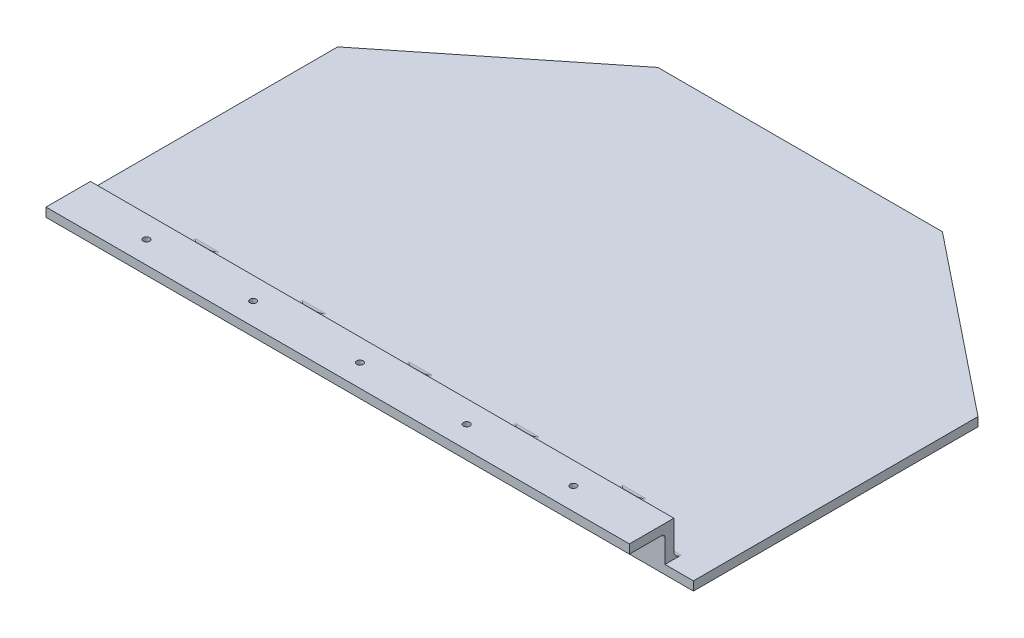
from build123d import *

# Parameters (mm, degrees)
BOSS_EXTRUDE1_DEPTH = 3.175
BOSS_EXTRUDE2_DEPTH = 228.6
BOSS_EXTRUDE3_DEPTH = 1.5875
LPATTERN1_COUNT     = 3
LPATTERN1_PITCH     = 38.1
LPATTERN1_COL_COUNT = 3
LPATTERN1_COL_PITCH = 38.1
SKETCH4_R           = 1.143
CUT_EXTRUDE1_DEPTH  = 192.160313938
LPATTERN2_COUNT     = 3
LPATTERN2_PITCH     = 38.1
LPATTERN2_COL_COUNT = 3
LPATTERN2_COL_PITCH = 38.1
SKETCH5_R           = 1.143
CUT_EXTRUDE3_DEPTH  = 189.638824874
LPATTERN3_COUNT     = 4
LPATTERN3_PITCH     = 38.1
CUT_EXTRUDE4_REACH  = 193.16
SKETCH6_W           = 10.16
SKETCH6_H           = 15.875
FILLET1_R           = 2.54
FILLET2_R           = 1.27


with BuildPart() as part:
    # Sketch1 → Boss-Extrude1 (new body)
    with BuildSketch(Plane(origin=(0, 0, 0), x_dir=(1, 0, 0), z_dir=(0, 1, 0))):
        Polygon((-114.3, 0), (114.3, 0), (114.3, 101.6), (50.8, 152.4), (-50.8, 152.4), (-114.3, 101.6), align=None)
    extrude(amount=BOSS_EXTRUDE1_DEPTH)

    # Sketch2 → Boss-Extrude2 (add)
    with BuildSketch(Plane(origin=(114.3, 0, 0), x_dir=(0, 0, -1), z_dir=(1, 0, 0))):
        Polygon((3.175, 3.175), (3.175, 15.875), (-12.7, 15.875), (-12.7, 12.7), (0, 12.7), (0, 3.175), align=None)
    extrude(amount=-BOSS_EXTRUDE2_DEPTH)

    # Sketch3 → Boss-Extrude3 (add, symmetric)
    with BuildSketch(Plane(origin=(0, 0, 0), x_dir=(0, 0, -1), z_dir=(1, 0, 0))):
        Polygon((3.175, 15.875), (15.875, 3.175), (3.175, 3.175), align=None)
    boss_extrude3 = extrude(amount=BOSS_EXTRUDE3_DEPTH, both=True)

    # LPattern1: Boss-Extrude3 ×3
    with Locations(*[(-i * LPATTERN1_PITCH, 0, 0) for i in range(1, LPATTERN1_COUNT)]):
        add(boss_extrude3)

    # LPattern1 col: Boss-Extrude3 ×3
    with Locations(*[(i * LPATTERN1_COL_PITCH, 0, 0) for i in range(1, LPATTERN1_COL_COUNT)]):
        add(boss_extrude3)

    # Sketch4 → Cut-Extrude1 (cut, through all)
    with BuildSketch(Plane(origin=(0, 15.875, 0), x_dir=(1, 0, 0), z_dir=(0, 1, 0))):
        with Locations(Location((0, -4.7625, 0), (0, 0, 270))):
            Circle(SKETCH4_R)
    cut_extrude1 = extrude(amount=-CUT_EXTRUDE1_DEPTH, mode=Mode.SUBTRACT)

    # LPattern2: Cut-Extrude1 ×3
    with Locations(*[(i * LPATTERN2_PITCH, 0, 0) for i in range(1, LPATTERN2_COUNT)]):
        add(cut_extrude1, mode=Mode.SUBTRACT)

    # LPattern2 col: Cut-Extrude1 ×3
    with Locations(*[(-i * LPATTERN2_COL_PITCH, 0, 0) for i in range(1, LPATTERN2_COL_COUNT)]):
        add(cut_extrude1, mode=Mode.SUBTRACT)

    # Sketch5 → Cut-Extrude3 (cut, through all)
    with BuildSketch(Plane(origin=(0, 0, -3.175), x_dir=(-1, 0, 0), z_dir=(0, 0, -1))):
        with Locations((-57.15, 8.382)):
            Circle(SKETCH5_R)
    cut_extrude3 = extrude(amount=-CUT_EXTRUDE3_DEPTH, mode=Mode.SUBTRACT)

    # LPattern3: Cut-Extrude3 ×4
    with Locations(*[(-i * LPATTERN3_PITCH, 0, 0) for i in range(1, LPATTERN3_COUNT)]):
        add(cut_extrude3, mode=Mode.SUBTRACT)

    # Cut-Extrude4: up to this face of the body (flat: up to its plane)
    cut_extrude4_end = Plane(part.part.faces().sort_by_distance((0, 3.175, -72.172492335))[0])
    # Sketch6 → Cut-Extrude4 (cut, up to the picked face)
    with BuildSketch(Plane(origin=(0, 15.875, 0), x_dir=(1, 0, 0), z_dir=(0, 1, 0)), mode=Mode.PRIVATE) as cut_extrude4_sk1:
        with Locations((109.22, -4.7625)):
            Rectangle(SKETCH6_W, SKETCH6_H)
    cut_extrude4_tool1 = split(extrude(cut_extrude4_sk1.sketch, amount=-CUT_EXTRUDE4_REACH, mode=Mode.PRIVATE), bisect_by=cut_extrude4_end, keep=Keep.BOTH, mode=Mode.PRIVATE)
    # Sketch6 → Cut-Extrude4 (cut, up to the picked face)
    with BuildSketch(Plane(origin=(0, 15.875, 0), x_dir=(1, 0, 0), z_dir=(0, 1, 0)), mode=Mode.PRIVATE) as cut_extrude4_sk2:
        with Locations((-109.22, -4.7625)):
            Rectangle(SKETCH6_W, SKETCH6_H)
    cut_extrude4_tool2 = split(extrude(cut_extrude4_sk2.sketch, amount=-CUT_EXTRUDE4_REACH, mode=Mode.PRIVATE), bisect_by=cut_extrude4_end, keep=Keep.BOTH, mode=Mode.PRIVATE)
    add(cut_extrude4_tool1.solids().sort_by(Axis((109.22, 15.875, 4.7625), (0, -1, 0)))[0], mode=Mode.SUBTRACT)
    add(cut_extrude4_tool2.solids().sort_by(Axis((-109.22, 15.875, 4.7625), (0, -1, 0)))[0], mode=Mode.SUBTRACT)

    # Fillet1
    # the kernel refuses this fillet: 2.54 mm, written as the material it adds along each edge
    with BuildSketch(Plane(origin=(-80.3275, 5.715, -5.715), x_dir=(0, 0, 1), z_dir=(1, 0, 0))) as fillet1_piece_1_section:
        Polygon((0, 0), (FILLET1_R, 0), (FILLET1_R, FILLET1_R), (0, FILLET1_R), align=None)
    fillet1_piece_1 = extrude(amount=FILLET1_R, mode=Mode.PRIVATE)
    fillet1_piece_1 = fillet1_piece_1 - Plane(origin=(-80.3275, 5.715, -5.715), x_dir=(0, 0.7071067811865475, -0.7071067811865475), z_dir=(1, 0, 0)) * Sphere(FILLET1_R, mode=Mode.PRIVATE)
    add(fillet1_piece_1)
    with BuildSketch(Plane(origin=(33.9725, 5.715, -5.715), x_dir=(1, 0, 0), z_dir=(0, -1, 0))) as fillet1_piece_2_section:
        Polygon((0, 0), (FILLET1_R, 0), (FILLET1_R, FILLET1_R), (0, FILLET1_R), align=None)
    fillet1_piece_2 = extrude(amount=FILLET1_R, mode=Mode.PRIVATE)
    fillet1_piece_2 = fillet1_piece_2 - Plane(origin=(33.9725, 5.715, -5.715), x_dir=(-0.7071067811865475, 0, -0.7071067811865475), z_dir=(0, -1, 0)) * Sphere(FILLET1_R, mode=Mode.PRIVATE)
    add(fillet1_piece_2)
    with BuildSketch(Plane(origin=(4.1275, 5.715, -5.715), x_dir=(0, 0, 1), z_dir=(0, -1, 0))) as fillet1_piece_3_section:
        Polygon((0, 0), (FILLET1_R, 0), (FILLET1_R, FILLET1_R), (0, FILLET1_R), align=None)
    fillet1_piece_3 = extrude(amount=FILLET1_R, mode=Mode.PRIVATE)
    fillet1_piece_3 = fillet1_piece_3 - Plane(origin=(4.1275, 5.715, -5.715), x_dir=(0.7071067811865475, 0, -0.7071067811865475), z_dir=(0, -1, 0)) * Sphere(FILLET1_R, mode=Mode.PRIVATE)
    add(fillet1_piece_3)
    with BuildSketch(Plane(origin=(-4.1275, 5.715, -5.715), x_dir=(0, 0, 1), z_dir=(1, 0, 0))) as fillet1_piece_4_section:
        Polygon((0, 0), (FILLET1_R, 0), (FILLET1_R, FILLET1_R), (0, FILLET1_R), align=None)
    fillet1_piece_4 = extrude(amount=FILLET1_R, mode=Mode.PRIVATE)
    fillet1_piece_4 = fillet1_piece_4 - Plane(origin=(-4.1275, 5.715, -5.715), x_dir=(0, 0.7071067811865475, -0.7071067811865475), z_dir=(1, 0, 0)) * Sphere(FILLET1_R, mode=Mode.PRIVATE)
    add(fillet1_piece_4)
    with BuildSketch(Plane(origin=(72.0725, 5.715, -5.715), x_dir=(0, -1, 0), z_dir=(0, 0, 1))) as fillet1_piece_5_section:
        Polygon((0, 0), (FILLET1_R, 0), (FILLET1_R, FILLET1_R), (0, FILLET1_R), align=None)
    fillet1_piece_5 = extrude(amount=FILLET1_R, mode=Mode.PRIVATE)
    fillet1_piece_5 = fillet1_piece_5 - Plane(origin=(72.0725, 5.715, -5.715), x_dir=(-0.7071067811865475, 0.7071067811865475, 0), z_dir=(0, 0, 1)) * Sphere(FILLET1_R, mode=Mode.PRIVATE)
    add(fillet1_piece_5)
    with BuildSketch(Plane(origin=(42.2275, 5.715, -5.715), x_dir=(-1, 0, 0), z_dir=(0, 0, 1))) as fillet1_piece_6_section:
        Polygon((0, 0), (FILLET1_R, 0), (FILLET1_R, FILLET1_R), (0, FILLET1_R), align=None)
    fillet1_piece_6 = extrude(amount=FILLET1_R, mode=Mode.PRIVATE)
    fillet1_piece_6 = fillet1_piece_6 - Plane(origin=(42.2275, 5.715, -5.715), x_dir=(0.7071067811865475, 0.7071067811865475, 0), z_dir=(0, 0, 1)) * Sphere(FILLET1_R, mode=Mode.PRIVATE)
    add(fillet1_piece_6)
    with BuildSketch(Plane(origin=(80.3275, 5.715, -5.715), x_dir=(-1, 0, 0), z_dir=(0, 0, 1))) as fillet1_piece_7_section:
        Polygon((0, 0), (FILLET1_R, 0), (FILLET1_R, FILLET1_R), (0, FILLET1_R), align=None)
    fillet1_piece_7 = extrude(amount=FILLET1_R, mode=Mode.PRIVATE)
    fillet1_piece_7 = fillet1_piece_7 - Plane(origin=(80.3275, 5.715, -5.715), x_dir=(0.7071067811865475, 0.7071067811865475, 0), z_dir=(0, 0, 1)) * Sphere(FILLET1_R, mode=Mode.PRIVATE)
    add(fillet1_piece_7)
    with BuildSketch(Plane(origin=(-33.9725, 5.715, -5.715), x_dir=(-1, 0, 0), z_dir=(0, 0, 1))) as fillet1_piece_8_section:
        Polygon((0, 0), (FILLET1_R, 0), (FILLET1_R, FILLET1_R), (0, FILLET1_R), align=None)
    fillet1_piece_8 = extrude(amount=FILLET1_R, mode=Mode.PRIVATE)
    fillet1_piece_8 = fillet1_piece_8 - Plane(origin=(-33.9725, 5.715, -5.715), x_dir=(0.7071067811865475, 0.7071067811865475, 0), z_dir=(0, 0, 1)) * Sphere(FILLET1_R, mode=Mode.PRIVATE)
    add(fillet1_piece_8)
    with BuildSketch(Plane(origin=(-42.2275, 5.715, -5.715), x_dir=(1, 0, 0), z_dir=(0, -1, 0))) as fillet1_piece_9_section:
        Polygon((0, 0), (FILLET1_R, 0), (FILLET1_R, FILLET1_R), (0, FILLET1_R), align=None)
    fillet1_piece_9 = extrude(amount=FILLET1_R, mode=Mode.PRIVATE)
    fillet1_piece_9 = fillet1_piece_9 - Plane(origin=(-42.2275, 5.715, -5.715), x_dir=(-0.7071067811865475, 0, -0.7071067811865475), z_dir=(0, -1, 0)) * Sphere(FILLET1_R, mode=Mode.PRIVATE)
    add(fillet1_piece_9)
    with BuildSketch(Plane(origin=(-72.0725, 5.715, -5.715), x_dir=(0, 0, 1), z_dir=(0, -1, 0))) as fillet1_piece_10_section:
        Polygon((0, 0), (FILLET1_R, 0), (FILLET1_R, FILLET1_R), (0, FILLET1_R), align=None)
    fillet1_piece_10 = extrude(amount=FILLET1_R, mode=Mode.PRIVATE)
    fillet1_piece_10 = fillet1_piece_10 - Plane(origin=(-72.0725, 5.715, -5.715), x_dir=(0.7071067811865475, 0, -0.7071067811865475), z_dir=(0, -1, 0)) * Sphere(FILLET1_R, mode=Mode.PRIVATE)
    add(fillet1_piece_10)
    with BuildSketch(Plane(origin=(-80.3275, 3.175, -3.175), x_dir=(0, 1, 0), z_dir=(-1, 0, 0)), Plane(origin=(104.14, 3.175, -3.175), x_dir=(0, 1, 0), z_dir=(-1, 0, 0))) as fillet1_piece_11:
        with BuildLine():
            CenterArc((FILLET1_R, FILLET1_R), FILLET1_R, 180, 90)
            Line((0, FILLET1_R), (0, 0))
            Line((0, 0), (FILLET1_R, 0))
        make_face()
    extrude(amount=23.8125)
    with BuildSketch(Plane(origin=(33.9725, 3.175, -3.175), x_dir=(0, 1, 0), z_dir=(-1, 0, 0)), Plane(origin=(72.0725, 3.175, -3.175), x_dir=(0, 1, 0), z_dir=(-1, 0, 0)), Plane(origin=(-4.1275, 3.175, -3.175), x_dir=(0, 1, 0), z_dir=(-1, 0, 0)), Plane(origin=(-42.2275, 3.175, -3.175), x_dir=(0, 1, 0), z_dir=(-1, 0, 0))) as fillet1_piece_12:
        with BuildLine():
            CenterArc((FILLET1_R, FILLET1_R), FILLET1_R, 180, 90)
            Line((0, FILLET1_R), (0, 0))
            Line((0, 0), (FILLET1_R, 0))
        make_face()
    extrude(amount=29.845)
    with BuildSketch(Plane(origin=(-1.5875, 5.715, -3.175), x_dir=(0, 0, -1), z_dir=(0, 1, 0))) as fillet1_piece_13_section:
        with BuildLine():
            CenterArc((FILLET1_R, FILLET1_R), FILLET1_R, 180, 90)
            Line((0, FILLET1_R), (0, 0))
            Line((0, 0), (FILLET1_R, 0))
        make_face()
    fillet1_piece_13 = extrude(amount=10.16, mode=Mode.PRIVATE)
    fillet1_piece_13 = split(fillet1_piece_13, bisect_by=Plane(origin=(-2.180886549, 12.926549303, -6.123450697), z_dir=(0, -0.7071067811865476, 0.7071067811865476)), keep=Keep.TOP, mode=Mode.PRIVATE)
    add(fillet1_piece_13)
    with BuildSketch(Plane(origin=(-1.5875, 3.175, -22.225), x_dir=(0, 1, 0), z_dir=(0, 0, 1))) as fillet1_piece_14_section:
        with BuildLine():
            CenterArc((FILLET1_R, FILLET1_R), FILLET1_R, 180, 90)
            Line((0, FILLET1_R), (0, 0))
            Line((0, 0), (FILLET1_R, 0))
        make_face()
    fillet1_piece_14 = extrude(amount=16.51, mode=Mode.PRIVATE)
    fillet1_piece_14 = split(fillet1_piece_14, bisect_by=Plane(origin=(-2.181024604, 6.122820249, -12.927179751), z_dir=(0, -0.7071067811865476, 0.7071067811865476)), keep=Keep.TOP, mode=Mode.PRIVATE)
    add(fillet1_piece_14)
    with BuildSketch(Plane(origin=(1.5875, 3.175, -15.875), x_dir=(0, 0.7071067811865488, 0.7071067811865464), z_dir=(-1, 0, 0)), Plane(origin=(39.6875, 3.175, -15.875), x_dir=(0, 0.7071067811865488, 0.7071067811865464), z_dir=(-1, 0, 0)), Plane(origin=(77.7875, 3.175, -15.875), x_dir=(0, 0.7071067811865491, 0.7071067811865461), z_dir=(-1, 0, 0)), Plane(origin=(-36.5125, 3.175, -15.875), x_dir=(0, 0.7071067811865488, 0.7071067811865464), z_dir=(-1, 0, 0)), Plane(origin=(-74.6125, 3.175, -15.875), x_dir=(0, 0.7071067811865486, 0.7071067811865465), z_dir=(-1, 0, 0))) as fillet1_piece_15:
        with BuildLine():
            CenterArc((FILLET1_R * 0.414213562373, FILLET1_R), FILLET1_R, 225, 45)
            Line((-FILLET1_R * 0.292893218813, FILLET1_R * 0.292893218813), (0, 0))
            Line((0, 0), (FILLET1_R * 0.414213562373, 0))
        make_face()
    extrude(amount=3.175)
    with BuildSketch(Plane(origin=(1.5875, 5.715, -3.175), x_dir=(1, 0, 0), z_dir=(0, 1, 0))) as fillet1_piece_16_section:
        with BuildLine():
            CenterArc((FILLET1_R, FILLET1_R), FILLET1_R, 180, 90)
            Line((0, FILLET1_R), (0, 0))
            Line((0, 0), (FILLET1_R, 0))
        make_face()
    fillet1_piece_16 = extrude(amount=10.16, mode=Mode.PRIVATE)
    fillet1_piece_16 = split(fillet1_piece_16, bisect_by=Plane(origin=(2.180886549, 12.926549303, -6.123450697), z_dir=(0, -0.7071067811865476, 0.7071067811865476)), keep=Keep.TOP, mode=Mode.PRIVATE)
    add(fillet1_piece_16)
    with BuildSketch(Plane(origin=(1.5875, 3.175, -22.225), x_dir=(0, 1, 0), z_dir=(0, 0, 1))) as fillet1_piece_17_section:
        with BuildLine():
            CenterArc((FILLET1_R, -FILLET1_R), FILLET1_R, 90, 90)
            Line((0, -FILLET1_R), (0, 0))
            Line((0, 0), (FILLET1_R, 0))
        make_face()
    fillet1_piece_17 = extrude(amount=16.51, mode=Mode.PRIVATE)
    fillet1_piece_17 = split(fillet1_piece_17, bisect_by=Plane(origin=(2.181024604, 6.122820249, -12.927179751), z_dir=(0, -0.7071067811865476, 0.7071067811865476)), keep=Keep.TOP, mode=Mode.PRIVATE)
    add(fillet1_piece_17)
    with BuildSketch(Plane(origin=(36.5125, 5.715, -3.175), x_dir=(0, 0, -1), z_dir=(0, 1, 0))) as fillet1_piece_18_section:
        with BuildLine():
            CenterArc((FILLET1_R, FILLET1_R), FILLET1_R, 180, 90)
            Line((0, FILLET1_R), (0, 0))
            Line((0, 0), (FILLET1_R, 0))
        make_face()
    fillet1_piece_18 = extrude(amount=10.16, mode=Mode.PRIVATE)
    fillet1_piece_18 = split(fillet1_piece_18, bisect_by=Plane(origin=(35.919113451, 12.926549303, -6.123450697), z_dir=(0, -0.7071067811865476, 0.7071067811865476)), keep=Keep.TOP, mode=Mode.PRIVATE)
    add(fillet1_piece_18)
    with BuildSketch(Plane(origin=(36.5125, 3.175, -22.225), x_dir=(0, 1, 0), z_dir=(0, 0, 1))) as fillet1_piece_19_section:
        with BuildLine():
            CenterArc((FILLET1_R, FILLET1_R), FILLET1_R, 180, 90)
            Line((0, FILLET1_R), (0, 0))
            Line((0, 0), (FILLET1_R, 0))
        make_face()
    fillet1_piece_19 = extrude(amount=16.51, mode=Mode.PRIVATE)
    fillet1_piece_19 = split(fillet1_piece_19, bisect_by=Plane(origin=(35.918975396, 6.122820249, -12.927179751), z_dir=(0, -0.7071067811865476, 0.7071067811865476)), keep=Keep.TOP, mode=Mode.PRIVATE)
    add(fillet1_piece_19)
    with BuildSketch(Plane(origin=(39.6875, 5.715, -3.175), x_dir=(1, 0, 0), z_dir=(0, 1, 0))) as fillet1_piece_20_section:
        with BuildLine():
            CenterArc((FILLET1_R, FILLET1_R), FILLET1_R, 180, 90)
            Line((0, FILLET1_R), (0, 0))
            Line((0, 0), (FILLET1_R, 0))
        make_face()
    fillet1_piece_20 = extrude(amount=10.16, mode=Mode.PRIVATE)
    fillet1_piece_20 = split(fillet1_piece_20, bisect_by=Plane(origin=(40.280886549, 12.926549303, -6.123450697), z_dir=(0, -0.7071067811865476, 0.7071067811865476)), keep=Keep.TOP, mode=Mode.PRIVATE)
    add(fillet1_piece_20)
    with BuildSketch(Plane(origin=(39.6875, 3.175, -22.225), x_dir=(0, 1, 0), z_dir=(0, 0, 1))) as fillet1_piece_21_section:
        with BuildLine():
            CenterArc((FILLET1_R, -FILLET1_R), FILLET1_R, 90, 90)
            Line((0, -FILLET1_R), (0, 0))
            Line((0, 0), (FILLET1_R, 0))
        make_face()
    fillet1_piece_21 = extrude(amount=16.51, mode=Mode.PRIVATE)
    fillet1_piece_21 = split(fillet1_piece_21, bisect_by=Plane(origin=(40.281024604, 6.122820249, -12.927179751), z_dir=(0, -0.7071067811865476, 0.7071067811865476)), keep=Keep.TOP, mode=Mode.PRIVATE)
    add(fillet1_piece_21)
    with BuildSketch(Plane(origin=(74.6125, 5.715, -3.175), x_dir=(-1, 0, 0), z_dir=(0, 1, 0))) as fillet1_piece_22_section:
        with BuildLine():
            CenterArc((FILLET1_R, -FILLET1_R), FILLET1_R, 90, 90)
            Line((0, -FILLET1_R), (0, 0))
            Line((0, 0), (FILLET1_R, 0))
        make_face()
    fillet1_piece_22 = extrude(amount=10.16, mode=Mode.PRIVATE)
    fillet1_piece_22 = split(fillet1_piece_22, bisect_by=Plane(origin=(74.019113451, 12.926549303, -6.123450697), z_dir=(0, -0.7071067811865476, 0.7071067811865476)), keep=Keep.TOP, mode=Mode.PRIVATE)
    add(fillet1_piece_22)
    with BuildSketch(Plane(origin=(74.6125, 3.175, -22.225), x_dir=(0, 1, 0), z_dir=(0, 0, 1))) as fillet1_piece_23_section:
        with BuildLine():
            CenterArc((FILLET1_R, FILLET1_R), FILLET1_R, 180, 90)
            Line((0, FILLET1_R), (0, 0))
            Line((0, 0), (FILLET1_R, 0))
        make_face()
    fillet1_piece_23 = extrude(amount=16.51, mode=Mode.PRIVATE)
    fillet1_piece_23 = split(fillet1_piece_23, bisect_by=Plane(origin=(74.018975396, 6.122820249, -12.927179751), z_dir=(0, -0.7071067811865476, 0.7071067811865476)), keep=Keep.TOP, mode=Mode.PRIVATE)
    add(fillet1_piece_23)
    with BuildSketch(Plane(origin=(77.7875, 5.715, -3.175), x_dir=(1, 0, 0), z_dir=(0, 1, 0))) as fillet1_piece_24_section:
        with BuildLine():
            CenterArc((FILLET1_R, FILLET1_R), FILLET1_R, 180, 90)
            Line((0, FILLET1_R), (0, 0))
            Line((0, 0), (FILLET1_R, 0))
        make_face()
    fillet1_piece_24 = extrude(amount=10.16, mode=Mode.PRIVATE)
    fillet1_piece_24 = split(fillet1_piece_24, bisect_by=Plane(origin=(78.380886549, 12.926549303, -6.123450697), z_dir=(0, -0.7071067811865476, 0.7071067811865476)), keep=Keep.TOP, mode=Mode.PRIVATE)
    add(fillet1_piece_24)
    with BuildSketch(Plane(origin=(77.7875, 3.175, -22.225), x_dir=(0, 1, 0), z_dir=(0, 0, 1))) as fillet1_piece_25_section:
        with BuildLine():
            CenterArc((FILLET1_R, -FILLET1_R), FILLET1_R, 90, 90)
            Line((0, -FILLET1_R), (0, 0))
            Line((0, 0), (FILLET1_R, 0))
        make_face()
    fillet1_piece_25 = extrude(amount=16.51, mode=Mode.PRIVATE)
    fillet1_piece_25 = split(fillet1_piece_25, bisect_by=Plane(origin=(78.381024604, 6.122820249, -12.927179751), z_dir=(0, -0.7071067811865476, 0.7071067811865476)), keep=Keep.TOP, mode=Mode.PRIVATE)
    add(fillet1_piece_25)
    with BuildSketch(Plane(origin=(-39.6875, 5.715, -3.175), x_dir=(0, 0, -1), z_dir=(0, 1, 0))) as fillet1_piece_26_section:
        with BuildLine():
            CenterArc((FILLET1_R, FILLET1_R), FILLET1_R, 180, 90)
            Line((0, FILLET1_R), (0, 0))
            Line((0, 0), (FILLET1_R, 0))
        make_face()
    fillet1_piece_26 = extrude(amount=10.16, mode=Mode.PRIVATE)
    fillet1_piece_26 = split(fillet1_piece_26, bisect_by=Plane(origin=(-40.280886549, 12.926549303, -6.123450697), z_dir=(0, -0.7071067811865476, 0.7071067811865476)), keep=Keep.TOP, mode=Mode.PRIVATE)
    add(fillet1_piece_26)
    with BuildSketch(Plane(origin=(-39.6875, 3.175, -22.225), x_dir=(0, 1, 0), z_dir=(0, 0, 1))) as fillet1_piece_27_section:
        with BuildLine():
            CenterArc((FILLET1_R, FILLET1_R), FILLET1_R, 180, 90)
            Line((0, FILLET1_R), (0, 0))
            Line((0, 0), (FILLET1_R, 0))
        make_face()
    fillet1_piece_27 = extrude(amount=16.51, mode=Mode.PRIVATE)
    fillet1_piece_27 = split(fillet1_piece_27, bisect_by=Plane(origin=(-40.281024604, 6.122820249, -12.927179751), z_dir=(0, -0.7071067811865476, 0.7071067811865476)), keep=Keep.TOP, mode=Mode.PRIVATE)
    add(fillet1_piece_27)
    with BuildSketch(Plane(origin=(-36.5125, 5.715, -3.175), x_dir=(1, 0, 0), z_dir=(0, 1, 0))) as fillet1_piece_28_section:
        with BuildLine():
            CenterArc((FILLET1_R, FILLET1_R), FILLET1_R, 180, 90)
            Line((0, FILLET1_R), (0, 0))
            Line((0, 0), (FILLET1_R, 0))
        make_face()
    fillet1_piece_28 = extrude(amount=10.16, mode=Mode.PRIVATE)
    fillet1_piece_28 = split(fillet1_piece_28, bisect_by=Plane(origin=(-35.919113451, 12.926549303, -6.123450697), z_dir=(0, -0.7071067811865476, 0.7071067811865476)), keep=Keep.TOP, mode=Mode.PRIVATE)
    add(fillet1_piece_28)
    with BuildSketch(Plane(origin=(-36.5125, 3.175, -22.225), x_dir=(0, 1, 0), z_dir=(0, 0, 1))) as fillet1_piece_29_section:
        with BuildLine():
            CenterArc((FILLET1_R, -FILLET1_R), FILLET1_R, 90, 90)
            Line((0, -FILLET1_R), (0, 0))
            Line((0, 0), (FILLET1_R, 0))
        make_face()
    fillet1_piece_29 = extrude(amount=16.51, mode=Mode.PRIVATE)
    fillet1_piece_29 = split(fillet1_piece_29, bisect_by=Plane(origin=(-35.918975396, 6.122820249, -12.927179751), z_dir=(0, -0.7071067811865476, 0.7071067811865476)), keep=Keep.TOP, mode=Mode.PRIVATE)
    add(fillet1_piece_29)
    with BuildSketch(Plane(origin=(-77.7875, 5.715, -3.175), x_dir=(0, 0, -1), z_dir=(0, 1, 0))) as fillet1_piece_30_section:
        with BuildLine():
            CenterArc((FILLET1_R, FILLET1_R), FILLET1_R, 180, 90)
            Line((0, FILLET1_R), (0, 0))
            Line((0, 0), (FILLET1_R, 0))
        make_face()
    fillet1_piece_30 = extrude(amount=10.16, mode=Mode.PRIVATE)
    fillet1_piece_30 = split(fillet1_piece_30, bisect_by=Plane(origin=(-78.380886549, 12.926549303, -6.123450697), z_dir=(0, -0.7071067811865476, 0.7071067811865476)), keep=Keep.TOP, mode=Mode.PRIVATE)
    add(fillet1_piece_30)
    with BuildSketch(Plane(origin=(-77.7875, 3.175, -22.225), x_dir=(0, 1, 0), z_dir=(0, 0, 1))) as fillet1_piece_31_section:
        with BuildLine():
            CenterArc((FILLET1_R, FILLET1_R), FILLET1_R, 180, 90)
            Line((0, FILLET1_R), (0, 0))
            Line((0, 0), (FILLET1_R, 0))
        make_face()
    fillet1_piece_31 = extrude(amount=16.51, mode=Mode.PRIVATE)
    fillet1_piece_31 = split(fillet1_piece_31, bisect_by=Plane(origin=(-78.381024604, 6.122820249, -12.927179751), z_dir=(0, -0.7071067811865476, 0.7071067811865476)), keep=Keep.TOP, mode=Mode.PRIVATE)
    add(fillet1_piece_31)
    with BuildSketch(Plane(origin=(-74.6125, 5.715, -3.175), x_dir=(1, 0, 0), z_dir=(0, 1, 0))) as fillet1_piece_32_section:
        with BuildLine():
            CenterArc((FILLET1_R, FILLET1_R), FILLET1_R, 180, 90)
            Line((0, FILLET1_R), (0, 0))
            Line((0, 0), (FILLET1_R, 0))
        make_face()
    fillet1_piece_32 = extrude(amount=10.16, mode=Mode.PRIVATE)
    fillet1_piece_32 = split(fillet1_piece_32, bisect_by=Plane(origin=(-74.019113451, 12.926549303, -6.123450697), z_dir=(0, -0.7071067811865476, 0.7071067811865476)), keep=Keep.TOP, mode=Mode.PRIVATE)
    add(fillet1_piece_32)
    with BuildSketch(Plane(origin=(-74.6125, 3.175, -22.225), x_dir=(0, 1, 0), z_dir=(0, 0, 1))) as fillet1_piece_33_section:
        with BuildLine():
            CenterArc((FILLET1_R, -FILLET1_R), FILLET1_R, 90, 90)
            Line((0, -FILLET1_R), (0, 0))
            Line((0, 0), (FILLET1_R, 0))
        make_face()
    fillet1_piece_33 = extrude(amount=16.51, mode=Mode.PRIVATE)
    fillet1_piece_33 = split(fillet1_piece_33, bisect_by=Plane(origin=(-74.018975396, 6.122820249, -12.927179751), z_dir=(0, -0.7071067811865476, 0.7071067811865476)), keep=Keep.TOP, mode=Mode.PRIVATE)
    add(fillet1_piece_33)
    with BuildSketch(Plane(origin=(1.5875, 3.175, -15.875), x_dir=(0, 0.7071067811865488, 0.7071067811865464), z_dir=(-1, 0, 0))) as fillet1_piece_34a_section:
        with BuildLine():
            CenterArc((FILLET1_R * 0.414213562373, FILLET1_R), FILLET1_R, 225, 45)
            Line((-FILLET1_R * 0.292893218813, FILLET1_R * 0.292893218813), (0, 0))
            Line((0, 0), (FILLET1_R * 0.414213562373, 0))
        make_face()
    fillet1_piece_34a = extrude(amount=5.805256121, mode=Mode.PRIVATE)
    fillet1_piece_34a = split(fillet1_piece_34a, bisect_by=Plane(origin=(-1.5875, 3.331997761, -15.940030602), z_dir=(-1, 0, 0)), keep=Keep.TOP, mode=Mode.PRIVATE)
    with BuildSketch(Plane(origin=(-1.5875, 3.175, -22.225), x_dir=(0, 1, 0), z_dir=(0, 0, 1))) as fillet1_piece_34b_section:
        with BuildLine():
            CenterArc((FILLET1_R, FILLET1_R), FILLET1_R, 180, 90)
            Line((0, FILLET1_R), (0, 0))
            Line((0, 0), (FILLET1_R, 0))
        make_face()
    fillet1_piece_34b = extrude(amount=16.51, mode=Mode.PRIVATE)
    fillet1_piece_34b = split(fillet1_piece_34b, bisect_by=Plane(origin=(-2.136964009, 2.051257073, -16.998742927), z_dir=(0, 0.7071067811865476, -0.7071067811865476)), keep=Keep.TOP, mode=Mode.PRIVATE)
    fillet1_piece_34 = fillet1_piece_34a & fillet1_piece_34b
    add(fillet1_piece_34)
    with BuildSketch(Plane(origin=(1.5875, 3.175, -22.225), x_dir=(0, 1, 0), z_dir=(0, 0, 1))) as fillet1_piece_35a_section:
        with BuildLine():
            CenterArc((FILLET1_R, -FILLET1_R), FILLET1_R, 90, 90)
            Line((0, -FILLET1_R), (0, 0))
            Line((0, 0), (FILLET1_R, 0))
        make_face()
    fillet1_piece_35a = extrude(amount=16.51, mode=Mode.PRIVATE)
    fillet1_piece_35a = split(fillet1_piece_35a, bisect_by=Plane(origin=(2.136964009, 2.051257073, -16.998742927), z_dir=(0, 0.7071067811865476, -0.7071067811865476)), keep=Keep.TOP, mode=Mode.PRIVATE)
    with BuildSketch(Plane(origin=(4.217756121, 3.175, -15.875), x_dir=(0, 0.7071067811865476, 0.7071067811865476), z_dir=(-1, 0, 0))) as fillet1_piece_35b_section:
        with BuildLine():
            CenterArc((FILLET1_R * 0.414213562373, FILLET1_R), FILLET1_R, 225, 45)
            Line((-FILLET1_R * 0.292893218813, FILLET1_R * 0.292893218813), (0, 0))
            Line((0, 0), (FILLET1_R * 0.414213562373, 0))
        make_face()
    fillet1_piece_35b = extrude(amount=5.805256121, mode=Mode.PRIVATE)
    fillet1_piece_35b = split(fillet1_piece_35b, bisect_by=Plane(origin=(1.5875, 3.331997761, -15.940030602), z_dir=(1, 0, 0)), keep=Keep.TOP, mode=Mode.PRIVATE)
    fillet1_piece_35 = fillet1_piece_35a & fillet1_piece_35b
    add(fillet1_piece_35)
    with BuildSketch(Plane(origin=(39.6875, 3.175, -15.875), x_dir=(0, 0.7071067811865488, 0.7071067811865464), z_dir=(-1, 0, 0))) as fillet1_piece_36a_section:
        with BuildLine():
            CenterArc((FILLET1_R * 0.414213562373, FILLET1_R), FILLET1_R, 225, 45)
            Line((-FILLET1_R * 0.292893218813, FILLET1_R * 0.292893218813), (0, 0))
            Line((0, 0), (FILLET1_R * 0.414213562373, 0))
        make_face()
    fillet1_piece_36a = extrude(amount=5.805256121, mode=Mode.PRIVATE)
    fillet1_piece_36a = split(fillet1_piece_36a, bisect_by=Plane(origin=(36.5125, 3.331997761, -15.940030602), z_dir=(-1, 0, 0)), keep=Keep.TOP, mode=Mode.PRIVATE)
    with BuildSketch(Plane(origin=(36.5125, 3.175, -22.225), x_dir=(0, 1, 0), z_dir=(0, 0, 1))) as fillet1_piece_36b_section:
        with BuildLine():
            CenterArc((FILLET1_R, FILLET1_R), FILLET1_R, 180, 90)
            Line((0, FILLET1_R), (0, 0))
            Line((0, 0), (FILLET1_R, 0))
        make_face()
    fillet1_piece_36b = extrude(amount=16.51, mode=Mode.PRIVATE)
    fillet1_piece_36b = split(fillet1_piece_36b, bisect_by=Plane(origin=(35.963035991, 2.051257073, -16.998742927), z_dir=(0, 0.7071067811865476, -0.7071067811865476)), keep=Keep.TOP, mode=Mode.PRIVATE)
    fillet1_piece_36 = fillet1_piece_36a & fillet1_piece_36b
    add(fillet1_piece_36)
    with BuildSketch(Plane(origin=(39.6875, 3.175, -22.225), x_dir=(0, 1, 0), z_dir=(0, 0, 1))) as fillet1_piece_37a_section:
        with BuildLine():
            CenterArc((FILLET1_R, -FILLET1_R), FILLET1_R, 90, 90)
            Line((0, -FILLET1_R), (0, 0))
            Line((0, 0), (FILLET1_R, 0))
        make_face()
    fillet1_piece_37a = extrude(amount=16.51, mode=Mode.PRIVATE)
    fillet1_piece_37a = split(fillet1_piece_37a, bisect_by=Plane(origin=(40.236964009, 2.051257073, -16.998742927), z_dir=(0, 0.7071067811865476, -0.7071067811865476)), keep=Keep.TOP, mode=Mode.PRIVATE)
    with BuildSketch(Plane(origin=(42.317756121, 3.175, -15.875), x_dir=(0, 0.7071067811865476, 0.7071067811865476), z_dir=(-1, 0, 0))) as fillet1_piece_37b_section:
        with BuildLine():
            CenterArc((FILLET1_R * 0.414213562373, FILLET1_R), FILLET1_R, 225, 45)
            Line((-FILLET1_R * 0.292893218813, FILLET1_R * 0.292893218813), (0, 0))
            Line((0, 0), (FILLET1_R * 0.414213562373, 0))
        make_face()
    fillet1_piece_37b = extrude(amount=5.805256121, mode=Mode.PRIVATE)
    fillet1_piece_37b = split(fillet1_piece_37b, bisect_by=Plane(origin=(39.6875, 3.331997761, -15.940030602), z_dir=(1, 0, 0)), keep=Keep.TOP, mode=Mode.PRIVATE)
    fillet1_piece_37 = fillet1_piece_37a & fillet1_piece_37b
    add(fillet1_piece_37)
    with BuildSketch(Plane(origin=(77.7875, 3.175, -15.875), x_dir=(0, 0.7071067811865491, 0.7071067811865461), z_dir=(-1, 0, 0))) as fillet1_piece_38a_section:
        with BuildLine():
            CenterArc((FILLET1_R * 0.414213562373, FILLET1_R), FILLET1_R, 225, 45)
            Line((-FILLET1_R * 0.292893218813, FILLET1_R * 0.292893218813), (0, 0))
            Line((0, 0), (FILLET1_R * 0.414213562373, 0))
        make_face()
    fillet1_piece_38a = extrude(amount=5.805256121, mode=Mode.PRIVATE)
    fillet1_piece_38a = split(fillet1_piece_38a, bisect_by=Plane(origin=(74.6125, 3.331997761, -15.940030602), z_dir=(-1, 0, 0)), keep=Keep.TOP, mode=Mode.PRIVATE)
    with BuildSketch(Plane(origin=(74.6125, 3.175, -22.225), x_dir=(0, 1, 0), z_dir=(0, 0, 1))) as fillet1_piece_38b_section:
        with BuildLine():
            CenterArc((FILLET1_R, FILLET1_R), FILLET1_R, 180, 90)
            Line((0, FILLET1_R), (0, 0))
            Line((0, 0), (FILLET1_R, 0))
        make_face()
    fillet1_piece_38b = extrude(amount=16.51, mode=Mode.PRIVATE)
    fillet1_piece_38b = split(fillet1_piece_38b, bisect_by=Plane(origin=(74.063035991, 2.051257073, -16.998742927), z_dir=(0, 0.7071067811865476, -0.7071067811865476)), keep=Keep.TOP, mode=Mode.PRIVATE)
    fillet1_piece_38 = fillet1_piece_38a & fillet1_piece_38b
    add(fillet1_piece_38)
    with BuildSketch(Plane(origin=(77.7875, 3.175, -22.225), x_dir=(0, 1, 0), z_dir=(0, 0, 1))) as fillet1_piece_39a_section:
        with BuildLine():
            CenterArc((FILLET1_R, -FILLET1_R), FILLET1_R, 90, 90)
            Line((0, -FILLET1_R), (0, 0))
            Line((0, 0), (FILLET1_R, 0))
        make_face()
    fillet1_piece_39a = extrude(amount=16.51, mode=Mode.PRIVATE)
    fillet1_piece_39a = split(fillet1_piece_39a, bisect_by=Plane(origin=(78.336964009, 2.051257073, -16.998742927), z_dir=(0, 0.7071067811865476, -0.7071067811865476)), keep=Keep.TOP, mode=Mode.PRIVATE)
    with BuildSketch(Plane(origin=(80.417756121, 3.175, -15.875), x_dir=(0, 0.7071067811865476, 0.7071067811865476), z_dir=(-1, 0, 0))) as fillet1_piece_39b_section:
        with BuildLine():
            CenterArc((FILLET1_R * 0.414213562373, FILLET1_R), FILLET1_R, 225, 45)
            Line((-FILLET1_R * 0.292893218813, FILLET1_R * 0.292893218813), (0, 0))
            Line((0, 0), (FILLET1_R * 0.414213562373, 0))
        make_face()
    fillet1_piece_39b = extrude(amount=5.805256121, mode=Mode.PRIVATE)
    fillet1_piece_39b = split(fillet1_piece_39b, bisect_by=Plane(origin=(77.7875, 3.331997761, -15.940030602), z_dir=(1, 0, 0)), keep=Keep.TOP, mode=Mode.PRIVATE)
    fillet1_piece_39 = fillet1_piece_39a & fillet1_piece_39b
    add(fillet1_piece_39)
    with BuildSketch(Plane(origin=(-36.5125, 3.175, -15.875), x_dir=(0, 0.7071067811865488, 0.7071067811865464), z_dir=(-1, 0, 0))) as fillet1_piece_40a_section:
        with BuildLine():
            CenterArc((FILLET1_R * 0.414213562373, FILLET1_R), FILLET1_R, 225, 45)
            Line((-FILLET1_R * 0.292893218813, FILLET1_R * 0.292893218813), (0, 0))
            Line((0, 0), (FILLET1_R * 0.414213562373, 0))
        make_face()
    fillet1_piece_40a = extrude(amount=5.805256121, mode=Mode.PRIVATE)
    fillet1_piece_40a = split(fillet1_piece_40a, bisect_by=Plane(origin=(-39.6875, 3.331997761, -15.940030602), z_dir=(-1, 0, 0)), keep=Keep.TOP, mode=Mode.PRIVATE)
    with BuildSketch(Plane(origin=(-39.6875, 3.175, -22.225), x_dir=(0, 1, 0), z_dir=(0, 0, 1))) as fillet1_piece_40b_section:
        with BuildLine():
            CenterArc((FILLET1_R, FILLET1_R), FILLET1_R, 180, 90)
            Line((0, FILLET1_R), (0, 0))
            Line((0, 0), (FILLET1_R, 0))
        make_face()
    fillet1_piece_40b = extrude(amount=16.51, mode=Mode.PRIVATE)
    fillet1_piece_40b = split(fillet1_piece_40b, bisect_by=Plane(origin=(-40.236964009, 2.051257073, -16.998742927), z_dir=(0, 0.7071067811865476, -0.7071067811865476)), keep=Keep.TOP, mode=Mode.PRIVATE)
    fillet1_piece_40 = fillet1_piece_40a & fillet1_piece_40b
    add(fillet1_piece_40)
    with BuildSketch(Plane(origin=(-36.5125, 3.175, -22.225), x_dir=(0, 1, 0), z_dir=(0, 0, 1))) as fillet1_piece_41a_section:
        with BuildLine():
            CenterArc((FILLET1_R, -FILLET1_R), FILLET1_R, 90, 90)
            Line((0, -FILLET1_R), (0, 0))
            Line((0, 0), (FILLET1_R, 0))
        make_face()
    fillet1_piece_41a = extrude(amount=16.51, mode=Mode.PRIVATE)
    fillet1_piece_41a = split(fillet1_piece_41a, bisect_by=Plane(origin=(-35.963035991, 2.051257073, -16.998742927), z_dir=(0, 0.7071067811865476, -0.7071067811865476)), keep=Keep.TOP, mode=Mode.PRIVATE)
    with BuildSketch(Plane(origin=(-33.882243879, 3.175, -15.875), x_dir=(0, 0.7071067811865476, 0.7071067811865476), z_dir=(-1, 0, 0))) as fillet1_piece_41b_section:
        with BuildLine():
            CenterArc((FILLET1_R * 0.414213562373, FILLET1_R), FILLET1_R, 225, 45)
            Line((-FILLET1_R * 0.292893218813, FILLET1_R * 0.292893218813), (0, 0))
            Line((0, 0), (FILLET1_R * 0.414213562373, 0))
        make_face()
    fillet1_piece_41b = extrude(amount=5.805256121, mode=Mode.PRIVATE)
    fillet1_piece_41b = split(fillet1_piece_41b, bisect_by=Plane(origin=(-36.5125, 3.331997761, -15.940030602), z_dir=(1, 0, 0)), keep=Keep.TOP, mode=Mode.PRIVATE)
    fillet1_piece_41 = fillet1_piece_41a & fillet1_piece_41b
    add(fillet1_piece_41)
    with BuildSketch(Plane(origin=(-74.6125, 3.175, -15.875), x_dir=(0, 0.7071067811865486, 0.7071067811865465), z_dir=(-1, 0, 0))) as fillet1_piece_42a_section:
        with BuildLine():
            CenterArc((FILLET1_R * 0.414213562373, FILLET1_R), FILLET1_R, 225, 45)
            Line((-FILLET1_R * 0.292893218813, FILLET1_R * 0.292893218813), (0, 0))
            Line((0, 0), (FILLET1_R * 0.414213562373, 0))
        make_face()
    fillet1_piece_42a = extrude(amount=5.805256121, mode=Mode.PRIVATE)
    fillet1_piece_42a = split(fillet1_piece_42a, bisect_by=Plane(origin=(-77.7875, 3.331997761, -15.940030602), z_dir=(-1, 0, 0)), keep=Keep.TOP, mode=Mode.PRIVATE)
    with BuildSketch(Plane(origin=(-77.7875, 3.175, -22.225), x_dir=(0, 1, 0), z_dir=(0, 0, 1))) as fillet1_piece_42b_section:
        with BuildLine():
            CenterArc((FILLET1_R, FILLET1_R), FILLET1_R, 180, 90)
            Line((0, FILLET1_R), (0, 0))
            Line((0, 0), (FILLET1_R, 0))
        make_face()
    fillet1_piece_42b = extrude(amount=16.51, mode=Mode.PRIVATE)
    fillet1_piece_42b = split(fillet1_piece_42b, bisect_by=Plane(origin=(-78.336964009, 2.051257073, -16.998742927), z_dir=(0, 0.7071067811865476, -0.7071067811865476)), keep=Keep.TOP, mode=Mode.PRIVATE)
    fillet1_piece_42 = fillet1_piece_42a & fillet1_piece_42b
    add(fillet1_piece_42)
    with BuildSketch(Plane(origin=(-74.6125, 3.175, -22.225), x_dir=(0, 1, 0), z_dir=(0, 0, 1))) as fillet1_piece_43a_section:
        with BuildLine():
            CenterArc((FILLET1_R, -FILLET1_R), FILLET1_R, 90, 90)
            Line((0, -FILLET1_R), (0, 0))
            Line((0, 0), (FILLET1_R, 0))
        make_face()
    fillet1_piece_43a = extrude(amount=16.51, mode=Mode.PRIVATE)
    fillet1_piece_43a = split(fillet1_piece_43a, bisect_by=Plane(origin=(-74.063035991, 2.051257073, -16.998742927), z_dir=(0, 0.7071067811865476, -0.7071067811865476)), keep=Keep.TOP, mode=Mode.PRIVATE)
    with BuildSketch(Plane(origin=(-71.982243879, 3.175, -15.875), x_dir=(0, 0.7071067811865476, 0.7071067811865476), z_dir=(-1, 0, 0))) as fillet1_piece_43b_section:
        with BuildLine():
            CenterArc((FILLET1_R * 0.414213562373, FILLET1_R), FILLET1_R, 225, 45)
            Line((-FILLET1_R * 0.292893218813, FILLET1_R * 0.292893218813), (0, 0))
            Line((0, 0), (FILLET1_R * 0.414213562373, 0))
        make_face()
    fillet1_piece_43b = extrude(amount=5.805256121, mode=Mode.PRIVATE)
    fillet1_piece_43b = split(fillet1_piece_43b, bisect_by=Plane(origin=(-74.6125, 3.331997761, -15.940030602), z_dir=(1, 0, 0)), keep=Keep.TOP, mode=Mode.PRIVATE)
    fillet1_piece_43 = fillet1_piece_43a & fillet1_piece_43b
    add(fillet1_piece_43)

    # Fillet2
    fillet2_edges = [part.edges().sort_by_distance(p)[0] for p in [
        (0, 12.7, 0),
    ]]
    fillet(fillet2_edges, radius=FILLET2_R)


solid = part.part
